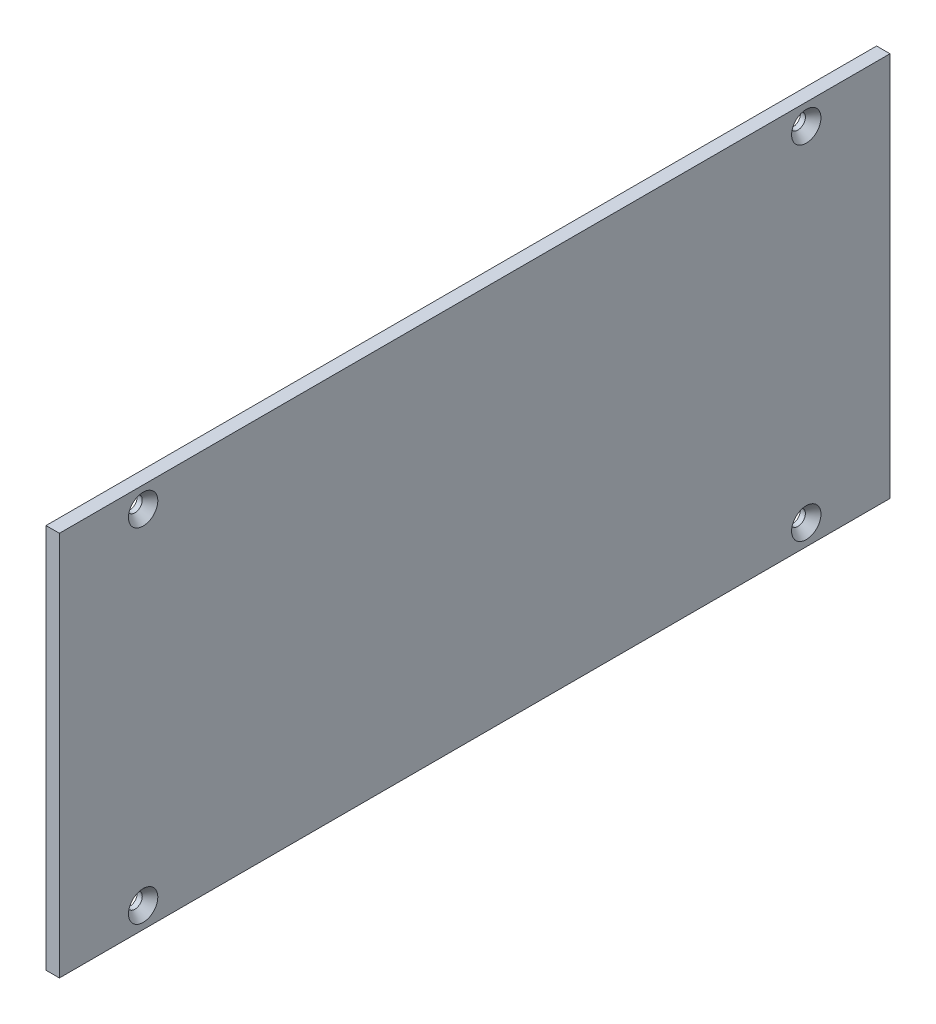
from build123d import *

# Parameters (mm, degrees)
SKETCH1_W                                     = 99.2004
SKETCH1_H                                     = 46
BOSS_EXTRUDE1_DEPTH                           = 1.6002
CSK_FOR_0_FLAT_HEAD_SOCKET_CAP_SCREW1_A_COUNT = 2
CSK_FOR_0_FLAT_HEAD_SOCKET_CAP_SCREW1_A_PITCH = 41
CSK_FOR_0_FLAT_HEAD_SOCKET_CAP_SCRE_2_COUNT   = 2
CSK_FOR_0_FLAT_HEAD_SOCKET_CAP_SCRE_2_PITCH   = 89.183537495
CSK_FOR_0_FLAT_HEAD_SOCKET_CAP_SCRE_3_COUNT   = 2
CSK_FOR_0_FLAT_HEAD_SOCKET_CAP_SCRE_3_PITCH   = 79.2004


with BuildPart() as part:
    # Sketch1 → Boss-Extrude1 (new body)
    with BuildSketch(Plane(origin=(0, 0, 0), x_dir=(0, 0, -1), z_dir=(1, 0, 0))):
        with Locations((49.6002, 23)):
            Rectangle(SKETCH1_W, SKETCH1_H)
    extrude(amount=BOSS_EXTRUDE1_DEPTH)

    # Sketch4 → CSK for #0 Flat Head Socket Cap Screw1 (revolve, cut)
    with BuildSketch(Plane(origin=(1.6002, 43.5, -10), x_dir=(0, 0, -1), z_dir=(0, 1, 0))):
        Polygon((0, 0), (0, 1.6002), (0.889, 1.6002), (0.889, 0.993458156), (1.7526, 0), align=None)
    csk_for_0_flat_head_socket_cap_screw1 = revolve(axis=Axis((7.9502, 43.5, -10), (-1, 0, 0)), mode=Mode.SUBTRACT)

    # CSK for #0 Flat Head Socket Cap Screw1 a: CSK for #0 Flat Head Socket Cap Screw1 ×2
    with Locations(*[(0, -i * CSK_FOR_0_FLAT_HEAD_SOCKET_CAP_SCREW1_A_PITCH, 0) for i in range(1, CSK_FOR_0_FLAT_HEAD_SOCKET_CAP_SCREW1_A_COUNT)]):
        add(csk_for_0_flat_head_socket_cap_screw1, mode=Mode.SUBTRACT)

    # CSK for _0 Flat Head Socket Cap Scre 2: CSK for #0 Flat Head Socket Cap Screw1 ×2
    with Locations(*[Vector(0, -0.4597261013805477, -0.8880607590190225) * (i * CSK_FOR_0_FLAT_HEAD_SOCKET_CAP_SCRE_2_PITCH) for i in range(1, CSK_FOR_0_FLAT_HEAD_SOCKET_CAP_SCRE_2_COUNT)]):
        add(csk_for_0_flat_head_socket_cap_screw1, mode=Mode.SUBTRACT)

    # CSK for _0 Flat Head Socket Cap Scre 3: CSK for #0 Flat Head Socket Cap Screw1 ×2
    with Locations(*[(0, 0, -i * CSK_FOR_0_FLAT_HEAD_SOCKET_CAP_SCRE_3_PITCH) for i in range(1, CSK_FOR_0_FLAT_HEAD_SOCKET_CAP_SCRE_3_COUNT)]):
        add(csk_for_0_flat_head_socket_cap_screw1, mode=Mode.SUBTRACT)


solid = part.part
